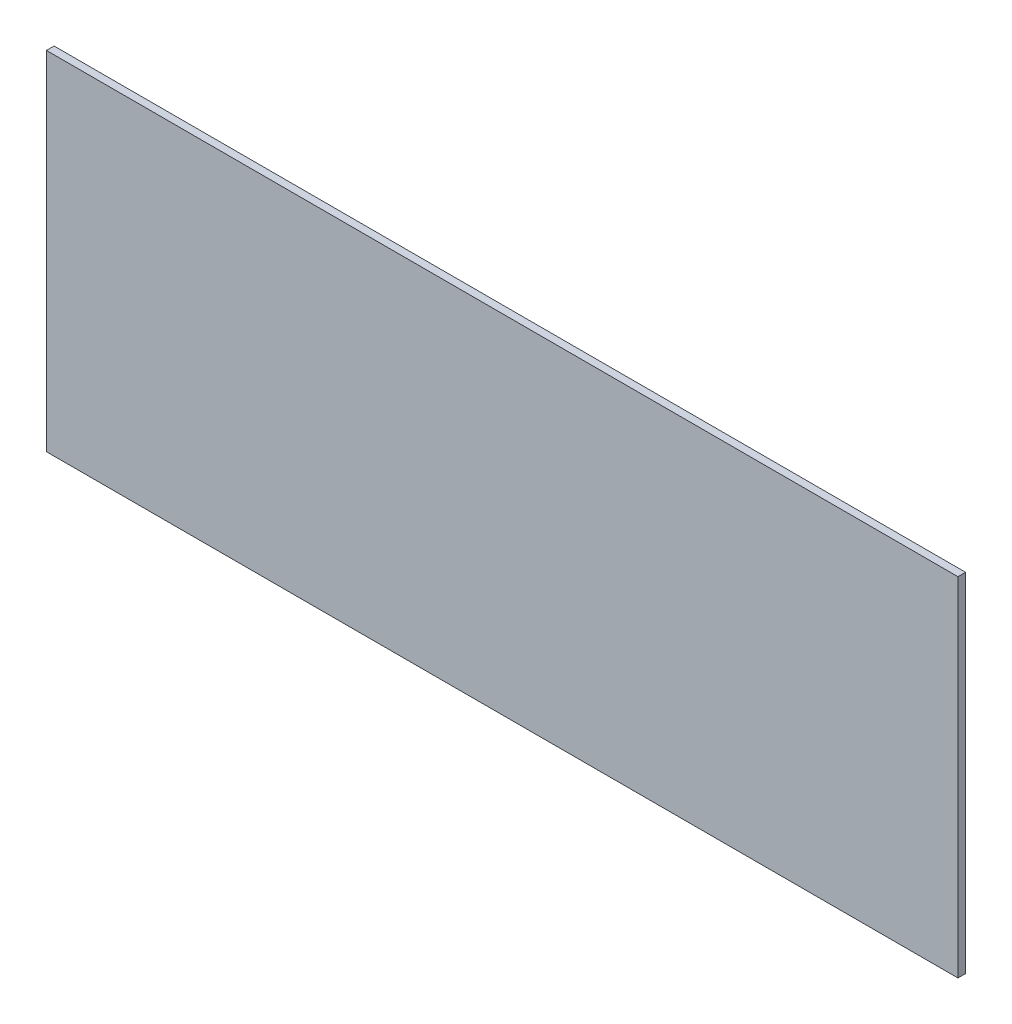
from build123d import *

# Parameters (mm, degrees)
SKETCH1_W           = 393.4
SKETCH1_H           = 150
BOSS_EXTRUDE1_DEPTH = 3.3


with BuildPart() as part:
    # Sketch1 → Boss-Extrude1 (new body)
    with BuildSketch(Plane.XY):
        with Locations((27, -50.5)):
            Rectangle(SKETCH1_W, SKETCH1_H)
    extrude(amount=BOSS_EXTRUDE1_DEPTH)


solid = part.part
